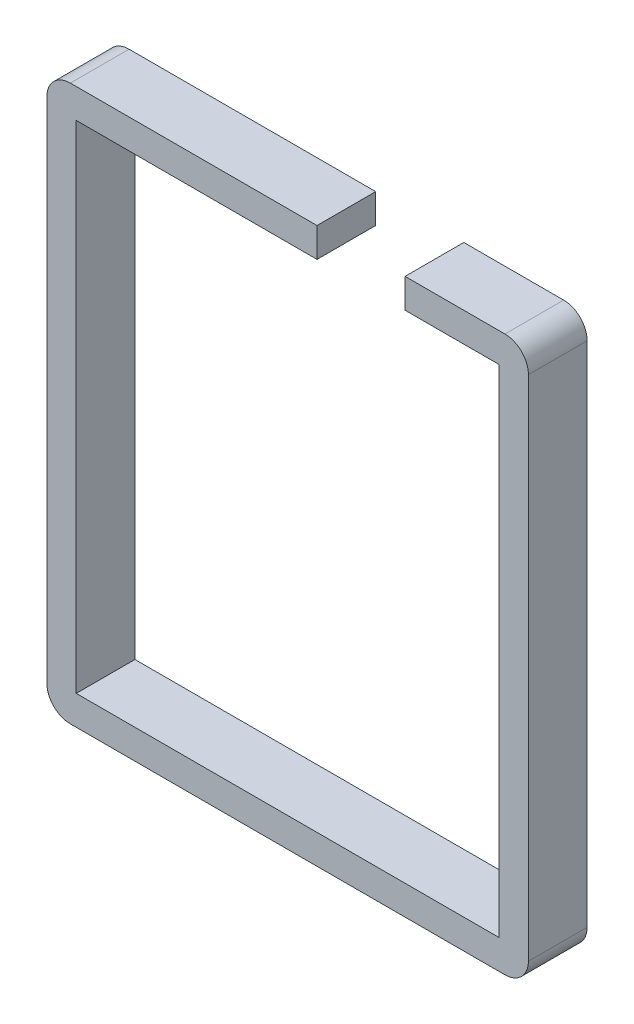
from build123d import *

# Parameters (mm, degrees)
BOSS_EXTRU_1_DEPTH = 10
CONG_3_R           = 4


with BuildPart() as part:
    # Esquisse1 → Boss.-Extru.1 (new body)
    with BuildSketch(Plane.XY):
        Polygon((0, 89.5), (0, 0), (5, 0), (82, 0), (82, 5), (82, 94.5), (77, 94.5), (61, 94.5), (61, 89.5), (77, 89.5), (77, 5), (5, 5), (5, 89.5), (46, 89.5), (46, 94.5), (0, 94.5), align=None)
    extrude(amount=BOSS_EXTRU_1_DEPTH)

    # Congé3
    cong_3_edges = [part.edges().sort_by_distance(p)[0] for p in [
        (0, 0, 5),
        (82, 0, 5),
        (82, 94.5, 5),
        (0, 94.5, 5),
    ]]
    fillet(cong_3_edges, radius=CONG_3_R)


solid = part.part
